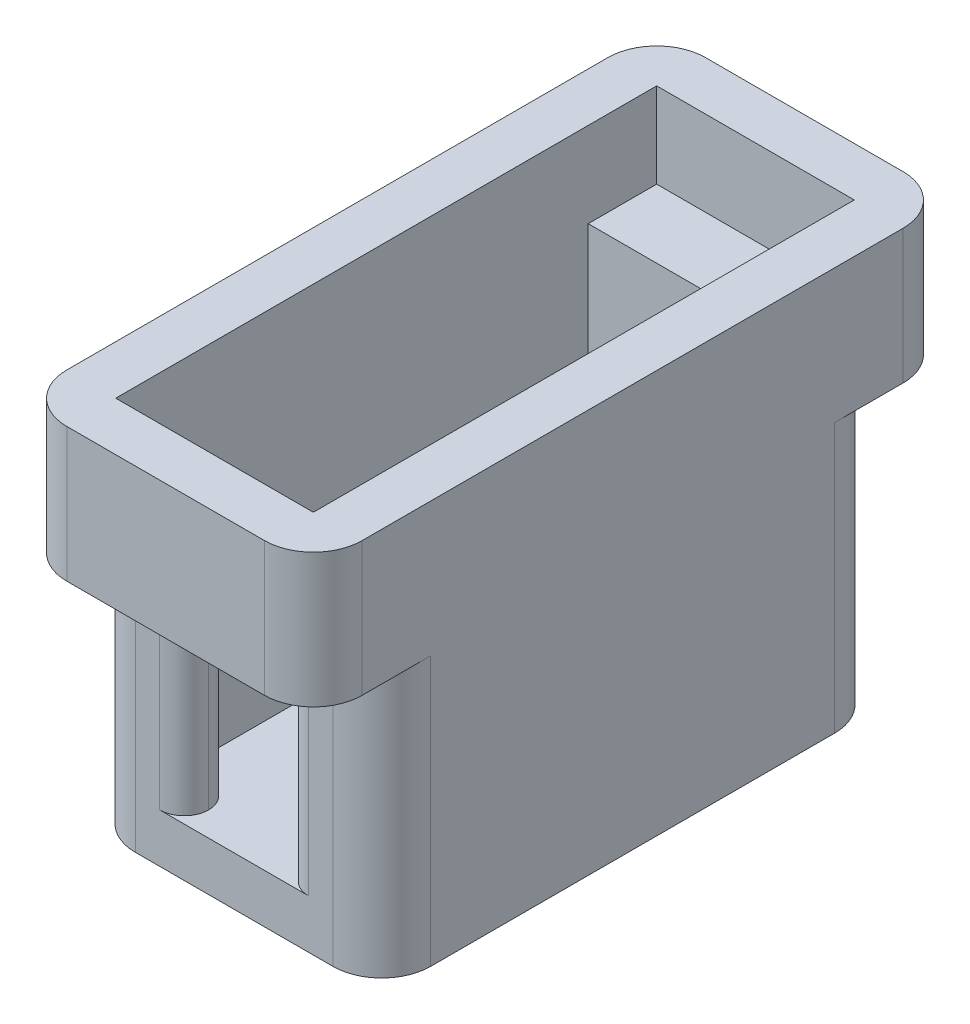
from build123d import *

# Parameters (mm, degrees)
SKETCH1_W           = 30.2
SKETCH1_H           = 51.3
BOSS_EXTRUDE1_DEPTH = 5
BOSS_EXTRUDE2_DEPTH = 27.5
SKETCH3_W           = 30.2
SKETCH3_H           = 5
BOSS_EXTRUDE3_DEPTH = 7
SKETCH4_W           = 30.2
SKETCH4_H           = 5
BOSS_EXTRUDE4_DEPTH = 7
SKETCH5_W           = 30.2
SKETCH5_H           = 65.3
SKETCH5_W_2         = 20.2
SKETCH5_H_2         = 55.3
BOSS_EXTRUDE5_DEPTH = 8.7
FILLET1_R           = 5
FILLET2_R           = 2.5
FILLET3_R           = 2.5


with BuildPart() as part:
    # Sketch1 → Boss-Extrude1 (new body)
    with BuildSketch(Plane(origin=(0, 0, 0), x_dir=(1, 0, 0), z_dir=(0, 1, 0))):
        Rectangle(SKETCH1_W, SKETCH1_H)
    extrude(amount=BOSS_EXTRUDE1_DEPTH)

    # Sketch2 → Boss-Extrude2 (add)
    with BuildSketch(Plane(origin=(0, 5, 0), x_dir=(1, 0, 0), z_dir=(0, 1, 0))):
        Polygon((10.1, -20.65), (5.1, -20.65), (5.1, -25.65), (15.1, -25.65), (15.1, 25.65), (-15.1, 25.65), (-15.1, -25.65), (-5.1, -25.65), (-5.1, -20.65), (-10.1, -20.65), (-10.1, 20.65), (10.1, 20.65), align=None)
    extrude(amount=BOSS_EXTRUDE2_DEPTH)

    # Sketch3 → Boss-Extrude3 (add)
    with BuildSketch(Plane.XY.offset(25.65)):
        with Locations((0, 30)):
            Rectangle(SKETCH3_W, SKETCH3_H)
    extrude(amount=BOSS_EXTRUDE3_DEPTH)

    # Sketch4 → Boss-Extrude4 (add)
    with BuildSketch(Plane(origin=(0, 0, -25.65), x_dir=(-1, 0, 0), z_dir=(0, 0, -1))):
        with Locations((0, 30)):
            Rectangle(SKETCH4_W, SKETCH4_H)
    extrude(amount=BOSS_EXTRUDE4_DEPTH)

    # Sketch5 → Boss-Extrude5 (add)
    with BuildSketch(Plane(origin=(0, 32.5, 0), x_dir=(1, 0, 0), z_dir=(0, 1, 0))):
        Rectangle(SKETCH5_W, SKETCH5_H)
        Rectangle(SKETCH5_W_2, SKETCH5_H_2, mode=Mode.SUBTRACT)
    extrude(amount=BOSS_EXTRUDE5_DEPTH)

    # Fillet1
    fillet1_edges = [part.edges().sort_by_distance(p)[0] for p in [
        (15.1, 13.75, 25.65),
        (-15.1, 13.75, 25.65),
        (-15.1, 34.35, 32.65),
        (15.1, 34.35, 32.65),
        (-15.1, 13.75, -25.65),
        (15.1, 13.75, -25.65),
        (15.1, 34.35, -32.65),
        (-15.1, 34.35, -32.65),
    ]]
    fillet(fillet1_edges, radius=FILLET1_R)

    # Fillet2
    fillet2_edges = [part.edges().sort_by_distance(p)[0] for p in [
        (-5.1, 16.25, 25.65),
        (5.1, 16.25, 25.65),
        (-5.1, 18.75, 20.65),
        (5.1, 18.75, 20.65),
    ]]
    fillet(fillet2_edges, radius=FILLET2_R - 0.0001)  # a hair under: the kernel refuses the full size

    # Fillet3
    fillet3_edges = [part.edges().sort_by_distance(p)[0] for p in [
        (-5.1, 30, 25.65),
        (5.1, 30, 25.65),
    ]]
    fillet(fillet3_edges, radius=FILLET3_R - 0.0001)  # a hair under: the kernel refuses the full size


solid = part.part
